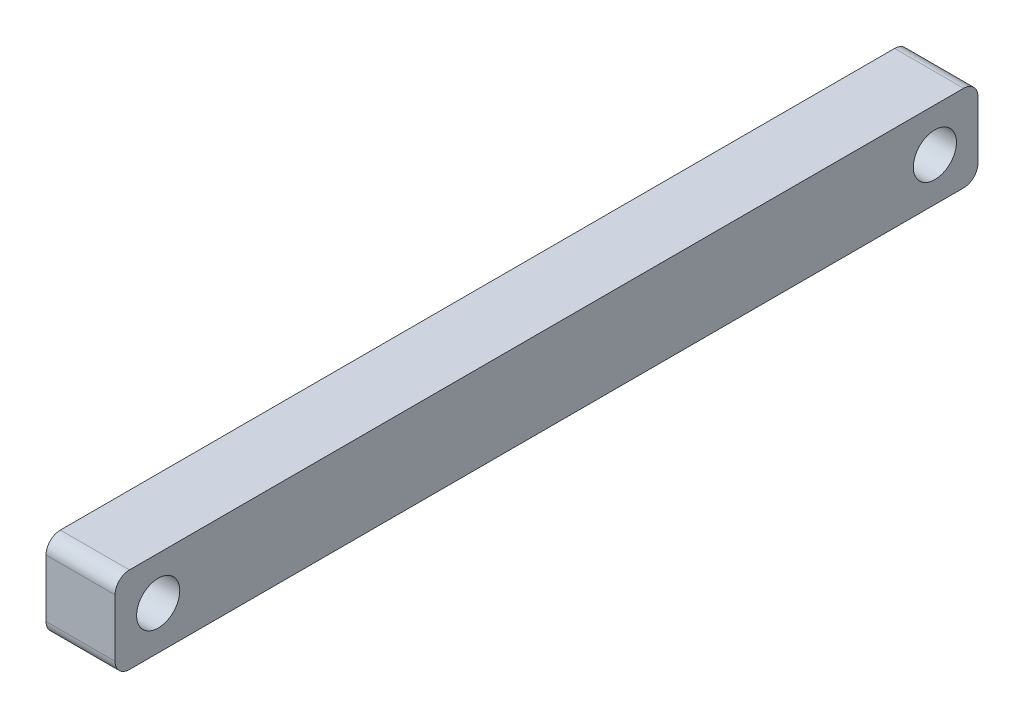
from build123d import *

# Parameters (mm, degrees)
SALIENTE_EXTRUIR1_DEPTH    = 2.4
CORTAR_EXTRUIR1_DEPTH      = 31.244999587
CORTAR_EXTRUIR1_DEPTH_BACK = 31.244999587
CROQUIS2_R                 = 1.5


with BuildPart() as part:
    # Croquis1 → Saliente-Extruir1 (new, symmetric)
    with BuildSketch(Plane(origin=(0, 0, 0), x_dir=(0, 0, -1), z_dir=(1, 0, 0))):
        with BuildLine():
            Line((-29, 3), (29, 3))
            ThreePointArc((29, 3), (29.707106781, 2.707106781), (30, 2))
            Line((30, 2), (30, -2))
            ThreePointArc((30, -2), (29.707106781, -2.707106781), (29, -3))
            Line((29, -3), (-29, -3))
            ThreePointArc((-29, -3), (-29.707106781, -2.707106781), (-30, -2))
            Line((-30, -2), (-30, 2))
            ThreePointArc((-30, 2), (-29.707106781, 2.707106781), (-29, 3))
        make_face()
    extrude(amount=SALIENTE_EXTRUIR1_DEPTH, both=True)

    # Croquis2 → Cortar-Extruir1 (cut, two sides: drawn at the far end of the back side and taken through both)
    with BuildSketch(Plane(origin=(0, 0, 0), x_dir=(0, 0, -1), z_dir=(1, 0, 0)).offset(-CORTAR_EXTRUIR1_DEPTH_BACK)):
        with Locations((-27, 0)):
            Circle(CROQUIS2_R)
        with Locations((27, 0)):
            Circle(CROQUIS2_R)
    extrude(amount=CORTAR_EXTRUIR1_DEPTH + CORTAR_EXTRUIR1_DEPTH_BACK, mode=Mode.SUBTRACT)


solid = part.part
